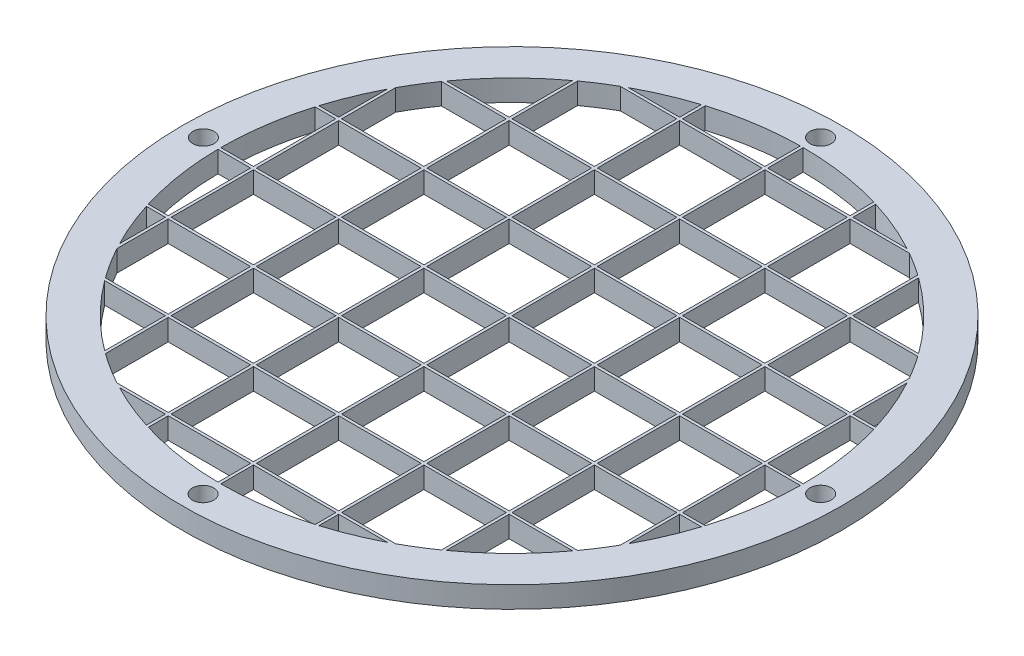
from build123d import *

# Parameters (mm, degrees)
SKETCH2_R           = 46
SKETCH2_R_2         = 41
BOSS_EXTRUDE2_DEPTH = 3
EXTRUDE_THIN5_START = -3
SKETCH4_R           = 46.4
SKETCH4_R_2         = 46
SKETCH4_W           = 0.4
SKETCH4_H           = 92
SKETCH4_H_2         = 88.814413244
SKETCH4_H_3         = 78.485667482
SKETCH4_H_4         = 57.271284254
SKETCH4_W_2         = 92
SKETCH4_H_5         = 0.4
SKETCH4_W_3         = 88.814413244
SKETCH4_W_4         = 78.485667482
SKETCH4_W_5         = 57.271284254
EXTRUDE_THIN5_DEPTH = 3
SKETCH5_R           = 1.5
CUT_EXTRUDE1_DEPTH  = 3
SKETCH6_R           = 1.5
CUT_EXTRUDE2_DEPTH  = 66.688050664


with BuildPart() as part:
    # Sketch2 → Boss-Extrude2 (new body)
    with BuildSketch(Plane(origin=(0, 0, 0), x_dir=(1, 0, 0), z_dir=(0, 1, 0))):
        Circle(SKETCH2_R)
        Circle(SKETCH2_R_2, mode=Mode.SUBTRACT)
    extrude(amount=BOSS_EXTRUDE2_DEPTH)

    # Sketch4 → Extrude-Thin5 (add)
    # profile 1 of 15: a face of its own
    with BuildSketch(Plane(origin=(0, 3, 0), x_dir=(1, 0, 0), z_dir=(0, 1, 0)).offset(EXTRUDE_THIN5_START)):
        Circle(SKETCH4_R)
        Circle(SKETCH4_R_2, mode=Mode.SUBTRACT)
    # profile 2 of 15: a face of its own
    with BuildSketch(Plane(origin=(0, 3, 0), x_dir=(1, 0, 0), z_dir=(0, 1, 0)).offset(EXTRUDE_THIN5_START)):
        with Locations((-0.2, 0)):
            Rectangle(SKETCH4_W, SKETCH4_H)
    # profile 3 of 15: a face of its own
    with BuildSketch(Plane(origin=(0, 3, 0), x_dir=(1, 0, 0), z_dir=(0, 1, 0)).offset(EXTRUDE_THIN5_START)):
        with Locations((11.8, 0)):
            Rectangle(SKETCH4_W, SKETCH4_H_2)
    # profile 4 of 15: a face of its own
    with BuildSketch(Plane(origin=(0, 3, 0), x_dir=(1, 0, 0), z_dir=(0, 1, 0)).offset(EXTRUDE_THIN5_START)):
        with Locations((23.8, 0)):
            Rectangle(SKETCH4_W, SKETCH4_H_3)
    # profile 5 of 15: a face of its own
    with BuildSketch(Plane(origin=(0, 3, 0), x_dir=(1, 0, 0), z_dir=(0, 1, 0)).offset(EXTRUDE_THIN5_START)):
        with Locations((35.8, 0)):
            Rectangle(SKETCH4_W, SKETCH4_H_4)
    # profile 6 of 15: a face of its own
    with BuildSketch(Plane(origin=(0, 3, 0), x_dir=(1, 0, 0), z_dir=(0, 1, 0)).offset(EXTRUDE_THIN5_START)):
        with Locations((-12.2, 0)):
            Rectangle(SKETCH4_W, SKETCH4_H_2)
    # profile 7 of 15: a face of its own
    with BuildSketch(Plane(origin=(0, 3, 0), x_dir=(1, 0, 0), z_dir=(0, 1, 0)).offset(EXTRUDE_THIN5_START)):
        with Locations((-24.2, 0)):
            Rectangle(SKETCH4_W, SKETCH4_H_3)
    # profile 8 of 15: a face of its own
    with BuildSketch(Plane(origin=(0, 3, 0), x_dir=(1, 0, 0), z_dir=(0, 1, 0)).offset(EXTRUDE_THIN5_START)):
        with Locations((-36.2, 0)):
            Rectangle(SKETCH4_W, SKETCH4_H_4)
    # profile 9 of 15: a face of its own
    with BuildSketch(Plane(origin=(0, 3, 0), x_dir=(1, 0, 0), z_dir=(0, 1, 0)).offset(EXTRUDE_THIN5_START)):
        with Locations((0, -0.2)):
            Rectangle(SKETCH4_W_2, SKETCH4_H_5)
    # profile 10 of 15: a face of its own
    with BuildSketch(Plane(origin=(0, 3, 0), x_dir=(1, 0, 0), z_dir=(0, 1, 0)).offset(EXTRUDE_THIN5_START)):
        with Locations((0, -12.2)):
            Rectangle(SKETCH4_W_3, SKETCH4_H_5)
    # profile 11 of 15: a face of its own
    with BuildSketch(Plane(origin=(0, 3, 0), x_dir=(1, 0, 0), z_dir=(0, 1, 0)).offset(EXTRUDE_THIN5_START)):
        with Locations((0, -24.2)):
            Rectangle(SKETCH4_W_4, SKETCH4_H_5)
    # profile 12 of 15: a face of its own
    with BuildSketch(Plane(origin=(0, 3, 0), x_dir=(1, 0, 0), z_dir=(0, 1, 0)).offset(EXTRUDE_THIN5_START)):
        with Locations((0, -36.2)):
            Rectangle(SKETCH4_W_5, SKETCH4_H_5)
    # profile 13 of 15: a face of its own
    with BuildSketch(Plane(origin=(0, 3, 0), x_dir=(1, 0, 0), z_dir=(0, 1, 0)).offset(EXTRUDE_THIN5_START)):
        with Locations((0, 11.8)):
            Rectangle(SKETCH4_W_3, SKETCH4_H_5)
    # profile 14 of 15: a face of its own
    with BuildSketch(Plane(origin=(0, 3, 0), x_dir=(1, 0, 0), z_dir=(0, 1, 0)).offset(EXTRUDE_THIN5_START)):
        with Locations((0, 23.8)):
            Rectangle(SKETCH4_W_4, SKETCH4_H_5)
    # profile 15 of 15: a face of its own
    with BuildSketch(Plane(origin=(0, 3, 0), x_dir=(1, 0, 0), z_dir=(0, 1, 0)).offset(EXTRUDE_THIN5_START)):
        with Locations((0, 35.8)):
            Rectangle(SKETCH4_W_5, SKETCH4_H_5)
    extrude(amount=EXTRUDE_THIN5_DEPTH)

    # Sketch5 → Cut-Extrude1 (cut)
    with BuildSketch(Plane.XZ):
        with Locations((0, -43.452428413)):
            Circle(SKETCH5_R)
        with Locations((-43.452428413, 0)):
            Circle(SKETCH5_R)
        with Locations((43.452428413, 0)):
            Circle(SKETCH5_R)
    extrude(amount=-CUT_EXTRUDE1_DEPTH, mode=Mode.SUBTRACT)

    # Sketch6 → Cut-Extrude2 (cut, through all)
    with BuildSketch(Plane(origin=(0, 3, 0), x_dir=(1, 0, 0), z_dir=(0, 1, 0))):
        with Locations((0, -43.5)):
            Circle(SKETCH6_R)
    extrude(amount=-CUT_EXTRUDE2_DEPTH, mode=Mode.SUBTRACT)


solid = part.part
